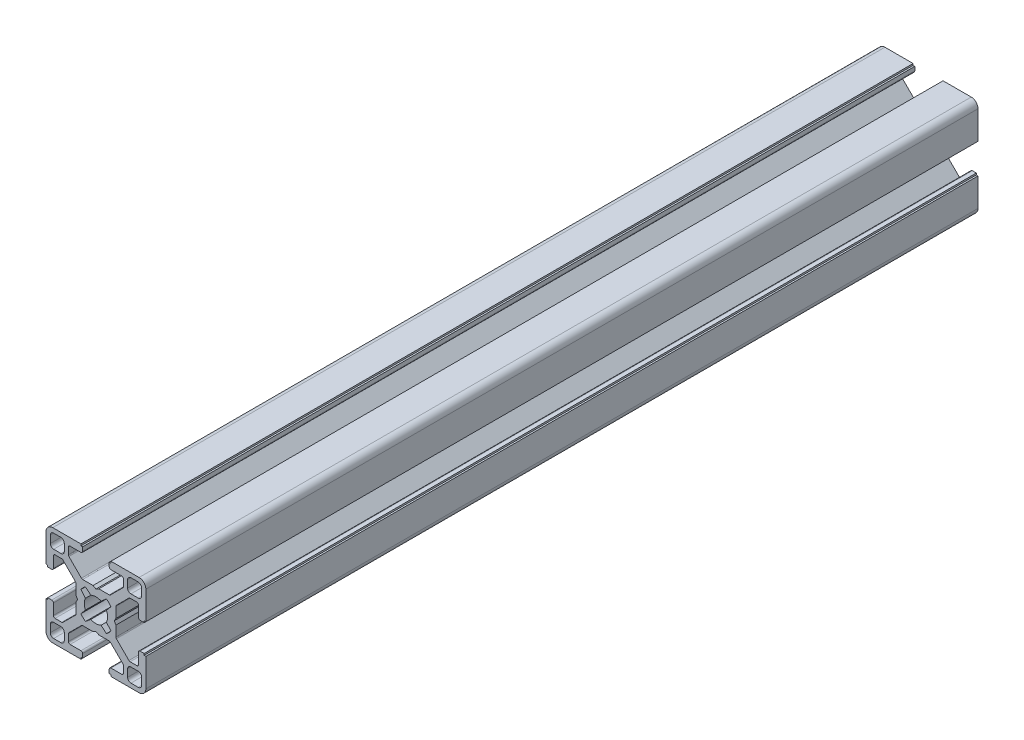
from build123d import *

# Parameters (mm, degrees)
BOSS_EXTRUDE1_DEPTH = 125
CIRPATTERN1_COUNT   = 4


with BuildPart() as part:
    # Sketch3 → Boss-Extrude1 (new, symmetric)
    with BuildSketch(Plane.XY):
        with BuildLine():
            Line((-4.503841895, 3.156803476), (-3.14772708, 1.530298739))
            ThreePointArc((-3.14772708, 1.530298739), (-3.410794979, 0.785160882), (-3.5, 0))
            Line((-3.5, 0), (-5.5, 0))
            Line((-5.5, 0), (-6, 0.866025404))
            Line((-6, 0.866025404), (-6, 3.996841995))
            ThreePointArc((-6, 3.996841995), (-6.038060234, 4.188183711), (-6.146446609, 4.350395385))
            Line((-6.146446609, 4.350395385), (-9.917104615, 8.121053391))
            ThreePointArc((-9.917104615, 8.121053391), (-10.079316289, 8.229439766), (-10.270658005, 8.2675))
            Line((-10.270658005, 8.2675), (-12.29, 8.2675))
            ThreePointArc((-12.29, 8.2675), (-12.643553391, 8.121053391), (-12.79, 7.7675))
            Line((-12.79, 7.7675), (-12.79, 4.5))
            ThreePointArc((-12.79, 4.5), (-12.936446609, 4.146446609), (-13.29, 4))
            Line((-13.29, 4), (-14.5, 4))
            Line((-14.5, 4), (-14.5, 4.5))
            Line((-14.5, 4.5), (-15, 4.5))
            Line((-15, 4.5), (-15, 12.968))
            ThreePointArc((-15, 12.968), (-14.404840979, 14.404840979), (-12.968, 15))
            Line((-12.968, 15), (-4.5, 15))
            Line((-4.5, 15), (-4.5, 14.5))
            Line((-4.5, 14.5), (-4, 14.5))
            Line((-4, 14.5), (-4, 13.29))
            ThreePointArc((-4, 13.29), (-4.146446609, 12.936446609), (-4.5, 12.79))
            Line((-4.5, 12.79), (-7.7675, 12.79))
            ThreePointArc((-7.7675, 12.79), (-8.121053391, 12.643553391), (-8.2675, 12.29))
            Line((-8.2675, 12.29), (-8.2675, 10.270658005))
            ThreePointArc((-8.2675, 10.270658005), (-8.229439766, 10.079316289), (-8.121053391, 9.917104615))
            Line((-8.121053391, 9.917104615), (-4.350395385, 6.146446609))
            ThreePointArc((-4.350395385, 6.146446609), (-4.188183711, 6.038060234), (-3.996841995, 6))
            Line((-3.996841995, 6), (-0.866025404, 6))
            Line((-0.866025404, 6), (0, 5.5))
            Line((0, 5.5), (0, 3.5))
            ThreePointArc((0, 3.5), (-0.785160882, 3.410794979), (-1.530298739, 3.14772708))
            Line((-1.530298739, 3.14772708), (-3.156803476, 4.503841895))
            ThreePointArc((-3.156803476, 4.503841895), (-3.889087297, 3.889087297), (-4.503841895, 3.156803476))
        make_face()
        with BuildLine():
            Line((-12.705, 9.5135), (-10.5135, 9.5135))
            ThreePointArc((-10.5135, 9.5135), (-9.806393219, 9.806393219), (-9.5135, 10.5135))
            Line((-9.5135, 10.5135), (-9.5135, 12.705))
            ThreePointArc((-9.5135, 12.705), (-9.806393219, 13.412106781), (-10.5135, 13.705))
            Line((-10.5135, 13.705), (-12.705, 13.705))
            ThreePointArc((-12.705, 13.705), (-13.412106781, 13.412106781), (-13.705, 12.705))
            Line((-13.705, 12.705), (-13.705, 10.5135))
            ThreePointArc((-13.705, 10.5135), (-13.412106781, 9.806393219), (-12.705, 9.5135))
        make_face(mode=Mode.SUBTRACT)
    boss_extrude1 = extrude(amount=BOSS_EXTRUDE1_DEPTH, both=True)

    # CirPattern1: Boss-Extrude1 ×4 about axis
    cirpattern1_axis = Axis((0, 0, 76.2), (0, 0, -1))
    for i in range(1, CIRPATTERN1_COUNT):
        add(boss_extrude1.rotate(cirpattern1_axis, i * 360 / CIRPATTERN1_COUNT))


solid = part.part
